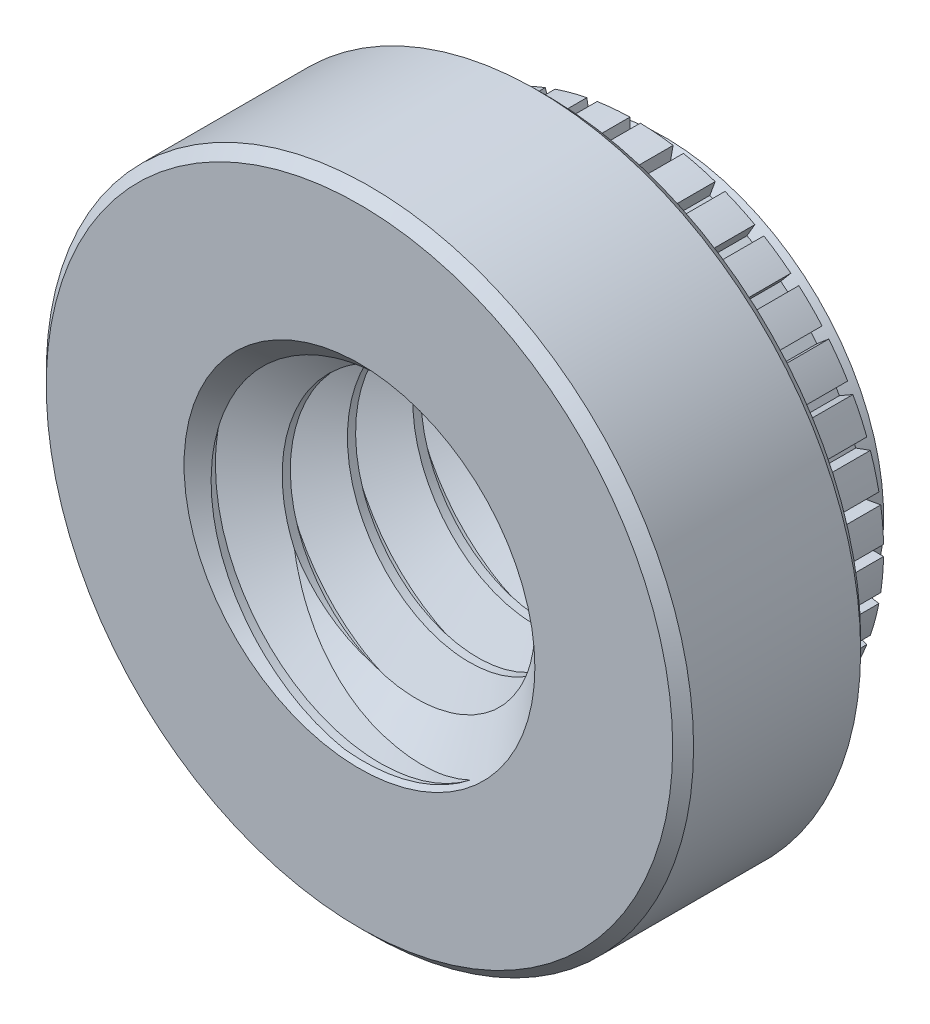
from build123d import *

# Parameters (mm, degrees)
SKETCH1_R               = 3.937
EXTRUDE1_DEPTH          = 2.286
SKETCH2_R               = 3.0226
EXTRUDE2_DEPTH          = 1.4224
SKETCH3_W               = 0.127
SKETCH3_H               = 1.1049
CUT_EXTRUDE_THIN1_DEPTH = 1.4224
CIRPATTERN1_COUNT       = 36
SKETCH5_OUTSIDE_W       = 12.48
SKETCH5_OUTSIDE_H       = 12.48
SKETCH5_OUTSIDE_R       = 2.667
CUT_EXTRUDE1_DEPTH      = 0.3556
CUT_EXTRUDE1_DRAFT      = 20
CHAMFER2_SIZE           = 0.127
SKETCH7_R               = 2.0828
CUT_EXTRUDE3_DEPTH      = 7.689706164
SWEEP1_PITCH            = 0.79375
SKETCH10_R              = 3.937
CUT_EXTRUDE4_DEPTH      = 8.098398955
SKETCH11_R              = 2.667
CUT_EXTRUDE5_DEPTH      = 7.689706219


with BuildPart() as part:
    # Sketch1 → Extrude1 (new body)
    with BuildSketch(Plane.XY):
        Circle(SKETCH1_R)
    extrude(amount=-EXTRUDE1_DEPTH)

    # Sketch2 → Extrude2 (add)
    with BuildSketch(Plane(origin=(0, 0, -2.286), x_dir=(-1, 0, 0), z_dir=(0, 0, -1))):
        with Locations(Location((0, 0, 0), (0, 0, 180))):
            Circle(SKETCH2_R)
    extrude(amount=EXTRUDE2_DEPTH)

    # Sketch3 → Cut-Extrude-Thin1 (cut)
    with BuildSketch(Plane(origin=(0, 0, -3.7084), x_dir=(-1, 0, 0), z_dir=(0, 0, -1))):
        with Locations((0, 3.38455)):
            Rectangle(SKETCH3_W, SKETCH3_H)
    cut_extrude_thin1 = extrude(amount=-CUT_EXTRUDE_THIN1_DEPTH, mode=Mode.SUBTRACT)

    # CirPattern1: Cut-Extrude-Thin1 ×36 about axis
    cirpattern1_axis = Axis((0, 0, 0), (0, 0, 1))
    for i in range(1, CIRPATTERN1_COUNT):
        add(cut_extrude_thin1.rotate(cirpattern1_axis, i * 360 / CIRPATTERN1_COUNT), mode=Mode.SUBTRACT)


with BuildPart() as cut_extrude1_tool:
    # Sketch5 outside → Cut-Extrude1 (with draft: the straight prism first)
    with BuildSketch(Plane(origin=(0, 0, -3.7084), x_dir=(-1, 0, 0), z_dir=(0, 0, -1))):
        Rectangle(SKETCH5_OUTSIDE_W, SKETCH5_OUTSIDE_H)
        Circle(SKETCH5_OUTSIDE_R, mode=Mode.SUBTRACT)
    extrude(amount=-CUT_EXTRUDE1_DEPTH)
    # Cut-Extrude1: the draft: its side faces are tilted about the plane it starts from
    cut_extrude1_sides = [cut_extrude1_tool.faces().sort_by_distance(p)[0] for p in [
        (0, -6.24, -3.5306),
        (-6.24, 0, -3.5306),
        (0, 6.24, -3.5306),
        (6.24, 0, -3.5306),
        (2.667, 0, -3.5306),
    ]]
    draft(cut_extrude1_sides, Plane(origin=(0, 0, -3.7084), x_dir=(-1, 0, 0), z_dir=(0, 0, -1)), CUT_EXTRUDE1_DRAFT)


with BuildPart() as part_1:
    add(part.part)

    # Cut-Extrude1: cut by cut_extrude1_tool
    add(cut_extrude1_tool.part, mode=Mode.SUBTRACT)

    # Chamfer2
    chamfer2_edges = [part_1.edges().sort_by_distance(p)[0] for p in [
        (-3.937, 0, 0),
        (-3.937, 0, -2.286),
    ]]
    chamfer(chamfer2_edges, length=CHAMFER2_SIZE)

    # Sketch7 → Cut-Extrude3 (cut, through all)
    with BuildSketch(Plane.XY):
        Circle(SKETCH7_R)
    extrude(amount=-CUT_EXTRUDE3_DEPTH, mode=Mode.SUBTRACT)

    # Sweep1: the profile of Sketch9 profile screwed along a right-hand helix of 8.672 turns, 6 arcs to a turn; built about Z, then put on its axis
    sweep1_z = Axis((0, 0, 0), (0, 0, 1))
    sweep1_corners = [(2.0831, 0, -0.694704455), (1.567244252, 0, -0.396875), (1.567244252, 0, -0.29765625), (2.0831, 0, 0.000173205)]
    with BuildLine(mode=Mode.PRIVATE) as sweep1_profile:
        Line(sweep1_corners[0], sweep1_corners[1])
        Line(sweep1_corners[1], sweep1_corners[2])
        Line(sweep1_corners[2], sweep1_corners[3])
        Line(sweep1_corners[3], sweep1_corners[0])
    sweep1_cap = Face(sweep1_profile.wire())
    sweep1_turn_angles = [0, 30, 60, 90, 120, 150, 180, 210, 240, 270, 300, 330, 360]
    sweep1_turn_weights = [1, 0.8660254037844387, 1, 0.8660254037844387, 1, 0.8660254037844387, 1, 0.8660254037844387, 1, 0.8660254037844387, 1, 0.8660254037844387, 1]
    sweep1_turn_rails = [Edge.make_bspline([Vector(p[0], p[1], 0).rotate(sweep1_z, sweep1_turn_angles[k]) / sweep1_turn_weights[k] + Vector(0, 0, p[2] + SWEEP1_PITCH * sweep1_turn_angles[k] / 360) for k in range(13)], [0, 0, 0, 1, 1, 2, 2, 3, 3, 4, 4, 5, 5, 6, 6, 6], 2, sweep1_turn_weights) for p in sweep1_corners]
    sweep1_turn_sides = [Face.make_surface_from_curves(sweep1_turn_rails[p[0]], sweep1_turn_rails[p[1]]) for p in [(0, 1), (1, 2), (2, 3), (3, 0)]]
    sweep1_last_angles = [2880, 2910, 2940, 2970, 3000, 3030, 3060, 3090, 3120, 3120.96, 3121.92]
    sweep1_last_weights = [1, 0.8660254037844387, 1, 0.8660254037844387, 1, 0.8660254037844387, 1, 0.8660254037844387, 1, 0.9998596355767787, 1]
    sweep1_last_rails = [Edge.make_bspline([Vector(p[0], p[1], 0).rotate(sweep1_z, sweep1_last_angles[k]) / sweep1_last_weights[k] + Vector(0, 0, p[2] + SWEEP1_PITCH * sweep1_last_angles[k] / 360) for k in range(11)], [0, 0, 0, 1, 1, 2, 2, 3, 3, 4, 4, 5, 5, 5], 2, sweep1_last_weights) for p in sweep1_corners]
    sweep1_last_sides = [Face.make_surface_from_curves(sweep1_last_rails[p[0]], sweep1_last_rails[p[1]]) for p in [(0, 1), (1, 2), (2, 3), (3, 0)]]
    sweep1 = Plane(origin=(0, 0, -3.7084), x_dir=(0, 1, 0), z_dir=(0, 0, 1)) * Solid(Shell([*[p.moved(Location((0, 0, SWEEP1_PITCH * i))) for i in range(8) for p in sweep1_turn_sides], *sweep1_last_sides, sweep1_cap, sweep1_cap.rotate(sweep1_z, 3121.92).moved(Location((0, 0, SWEEP1_PITCH * 3121.92 / 360)))]))
    add(sweep1)

    # Sketch10 → Cut-Extrude4 (cut, through all)
    with BuildSketch(Plane.XY):
        Circle(SKETCH10_R)
    extrude(amount=CUT_EXTRUDE4_DEPTH, mode=Mode.SUBTRACT)

    # Sketch11 → Cut-Extrude5 (cut, through all)
    with BuildSketch(Plane(origin=(0, 0, -3.7084), x_dir=(-1, 0, 0), z_dir=(0, 0, -1))):
        Circle(SKETCH11_R)
    extrude(amount=CUT_EXTRUDE5_DEPTH, mode=Mode.SUBTRACT)

    # Cut-Extrude6 cone 1 section (through the dimple's axis) → Cut-Extrude6 (revolve, cut)
    with BuildSketch(Plane(origin=(0, 0, 0), x_dir=(0, -1, 0), z_dir=(1, 0, 0))):
        Polygon((0, 0), (2.1336, 0), (0, 2.1336), align=None)
    revolve(axis=Axis((0, 0, 0), (0, 0, -1)), mode=Mode.SUBTRACT)

    # Cut-Extrude7 cone 1 section (through the dimple's axis) → Cut-Extrude7 (revolve, cut)
    with BuildSketch(Plane(origin=(0, 0, -3.7084), x_dir=(0, 1, 0), z_dir=(1, 0, 0))):
        Polygon((0, 0), (2.1336, 0), (0, 2.1336), align=None)
    revolve(axis=Axis((0, 0, -3.7084), (0, 0, 1)), mode=Mode.SUBTRACT)


solid = part_1.part
